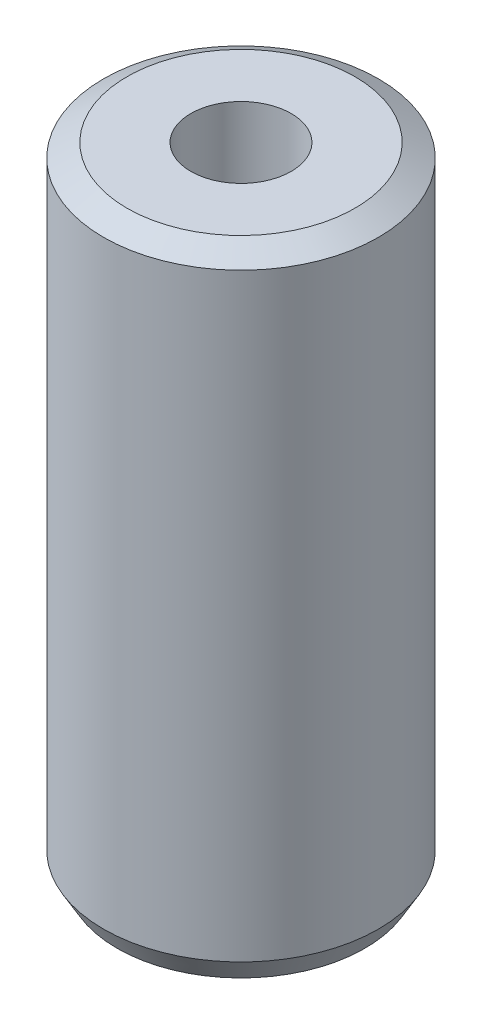
from build123d import *
from OCP.BRepFilletAPI import BRepFilletAPI_MakeChamfer

# Parameters (mm, degrees)
SKETCH1_R           = 20
BOSS_EXTRUDE1_DEPTH = 92.585978431
SKETCH2_R           = 7.307477689
CUT_EXTRUDE1_DEPTH  = 97.809934418
CHAMFER1_SIZE       = 1.967152906
CHAMFER1_SIZE2      = 3.407208779


with BuildPart() as part:
    # Sketch1 → Boss-Extrude1 (new body)
    with BuildSketch(Plane(origin=(0, 0, 0), x_dir=(1, 0, 0), z_dir=(0, 1, 0))):
        Circle(SKETCH1_R)
    extrude(amount=BOSS_EXTRUDE1_DEPTH)

    # Sketch2 → Cut-Extrude1 (cut, through all)
    with BuildSketch(Plane(origin=(0, 0, 0), x_dir=(1, 0, 0), z_dir=(0, 1, 0))):
        Circle(SKETCH2_R)
    extrude(amount=CUT_EXTRUDE1_DEPTH, mode=Mode.SUBTRACT)

    # Chamfer1: one chamfer whose edges measure the first distance from different faces: ONE call of the kernel's chamfer builder (chamfer() names one face for all edges)
    chamfer1_edges_1 = [part.edges().sort_by_distance(p)[0] for p in [
        (-20, 92.585978431, 0),
    ]]
    chamfer1_side_1 = [part.faces().sort_by_distance(p)[0] for p in [
        (-20, 46.292989215, 0),
    ]]
    chamfer1_edges_2 = [part.edges().sort_by_distance(p)[0] for p in [
        (-20, 0, 0),
    ]]
    chamfer1_side_2 = [part.faces().sort_by_distance(p)[0] for p in [
        (-19.434314575, 0, 0),
    ]]
    chamfer1 = BRepFilletAPI_MakeChamfer(part.part.solid().wrapped)
    for e in chamfer1_edges_1:
        chamfer1.Add(CHAMFER1_SIZE, CHAMFER1_SIZE2, e.wrapped, chamfer1_side_1[0].wrapped)  # the first distance lies on this face
    for e in chamfer1_edges_2:
        chamfer1.Add(CHAMFER1_SIZE, CHAMFER1_SIZE2, e.wrapped, chamfer1_side_2[0].wrapped)  # the first distance lies on this face
    add(Compound.cast(chamfer1.Shape()), mode=Mode.REPLACE)


solid = part.part
